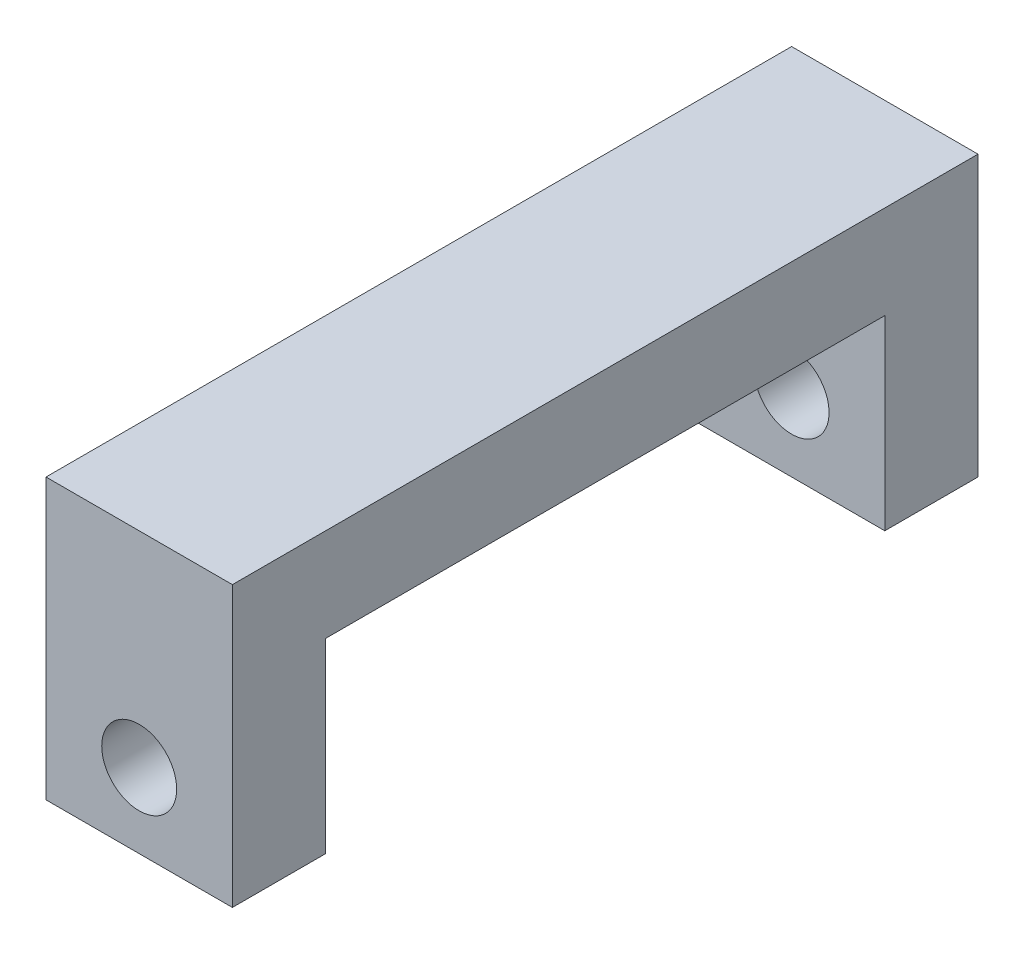
from build123d import *

# Parameters (mm, degrees)
BOSS_EXTRUDE1_DEPTH         = 12.7
TAP_DRILL_FOR_1_4_20_TAP1_D = 5.1054


with BuildPart() as part:
    # Sketch1 → Boss-Extrude1 (new body)
    with BuildSketch(Plane(origin=(0, 0, 0), x_dir=(0, 0, -1), z_dir=(1, 0, 0))):
        Polygon((25.4, 0), (-25.4, 0), (-25.4, -19.05), (-19.05, -19.05), (-19.05, -6.35), (19.05, -6.35), (19.05, -19.05), (25.4, -19.05), align=None)
    extrude(amount=BOSS_EXTRUDE1_DEPTH)

    # Tap Drill for 1/4-20 Tap1 (through all)
    with Locations(Plane(origin=(6.35, -13.97, -25.4), x_dir=(-1, 0, 0), z_dir=(0, 0, -1))):
        with Locations((0, 0)):
            Hole(TAP_DRILL_FOR_1_4_20_TAP1_D / 2)


solid = part.part
